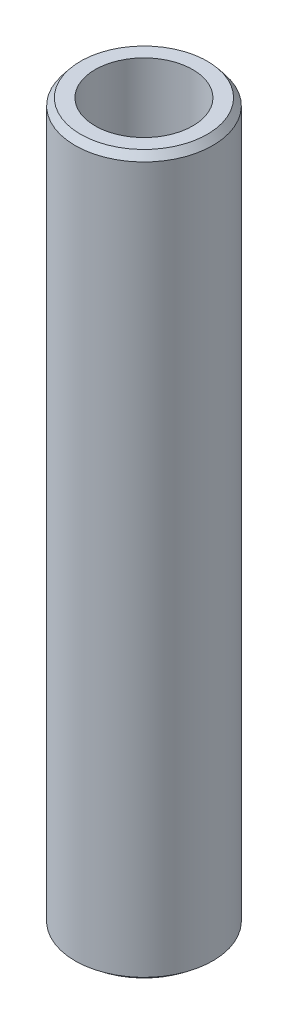
from build123d import *
from OCP.BRepFilletAPI import BRepFilletAPI_MakeChamfer

# Parameters (mm, degrees)
SKETCH1_R           = 57.5
BOSS_EXTRUDE1_DEPTH = 600
SKETCH2_R           = 40.766416512
CUT_EXTRUDE1_DEPTH  = 606.485342515
CHAMFER1_SIZE       = 5.810164534
CHAMFER1_SIZE2      = 4.586739786


with BuildPart() as part:
    # Sketch1 → Boss-Extrude1 (new body)
    with BuildSketch(Plane(origin=(0, 0, 0), x_dir=(1, 0, 0), z_dir=(0, 1, 0))):
        Circle(SKETCH1_R)
    extrude(amount=BOSS_EXTRUDE1_DEPTH)

    # Sketch2 → Cut-Extrude1 (cut, through all)
    with BuildSketch(Plane(origin=(0, 0, 0), x_dir=(1, 0, 0), z_dir=(0, 1, 0))):
        Circle(SKETCH2_R)
    extrude(amount=CUT_EXTRUDE1_DEPTH, mode=Mode.SUBTRACT)

    # Chamfer1: one chamfer whose edges measure the first distance from different faces: ONE call of the kernel's chamfer builder (chamfer() names one face for all edges)
    chamfer1_edges_1 = [part.edges().sort_by_distance(p)[0] for p in [
        (-57.5, 600, 0),
    ]]
    chamfer1_side_1 = [part.faces().sort_by_distance(p)[0] for p in [
        (-57.5, 300, 0),
    ]]
    chamfer1_edges_2 = [part.edges().sort_by_distance(p)[0] for p in [
        (-57.5, 0, 0),
    ]]
    chamfer1_side_2 = [part.faces().sort_by_distance(p)[0] for p in [
        (-55.873654403, 0, 0),
    ]]
    chamfer1 = BRepFilletAPI_MakeChamfer(part.part.solid().wrapped)
    for e in chamfer1_edges_1:
        chamfer1.Add(CHAMFER1_SIZE, CHAMFER1_SIZE2, e.wrapped, chamfer1_side_1[0].wrapped)  # the first distance lies on this face
    for e in chamfer1_edges_2:
        chamfer1.Add(CHAMFER1_SIZE, CHAMFER1_SIZE2, e.wrapped, chamfer1_side_2[0].wrapped)  # the first distance lies on this face
    add(Compound.cast(chamfer1.Shape()), mode=Mode.REPLACE)


solid = part.part
